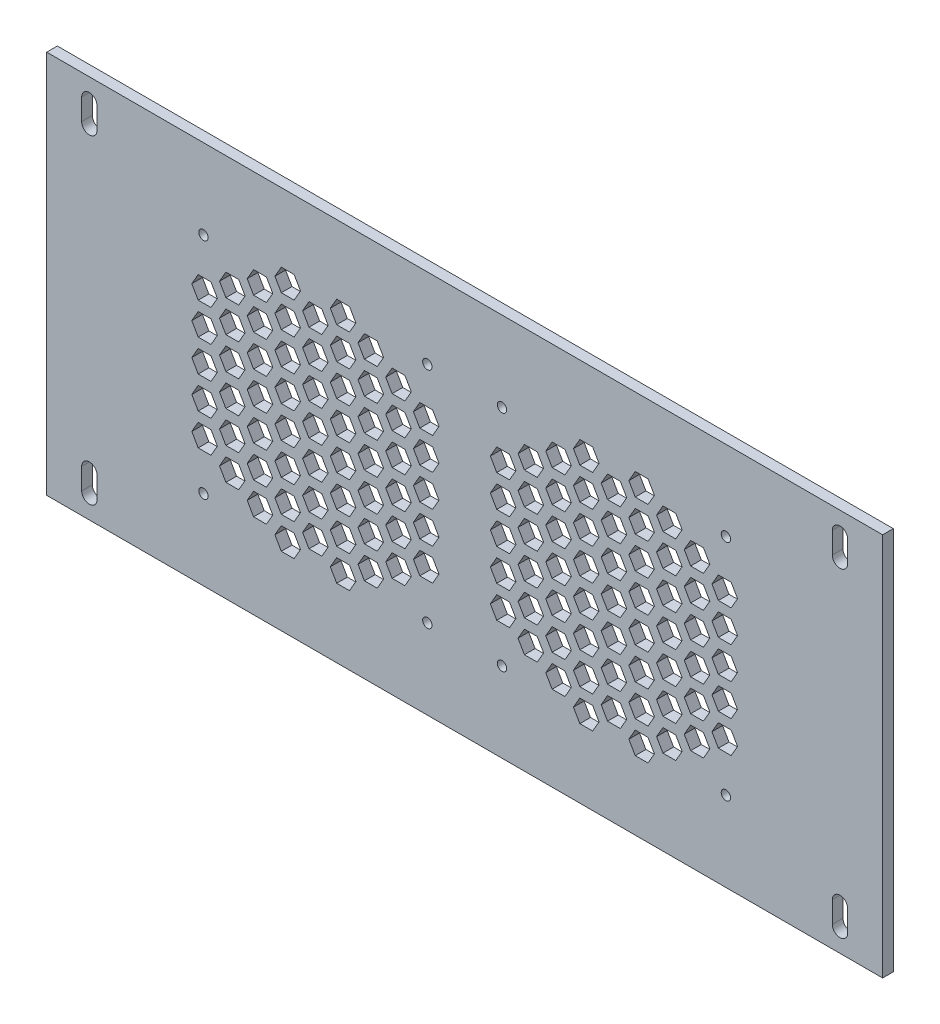
from build123d import *

# Parameters (mm, degrees)
SKETCH1_W                                = 392
SKETCH1_H                                = 180
BOSS_EXTRUDE1_DEPTH                      = 5
CUT_EXTRUDE3_REACH                       = 217.734
MIRROR1_AT_THE_SECOND_PLANE_COPY_1_REACH = 217.734
CUT_EXTRUDE2_REACH                       = 217.734
SKETCH4_R                                = 2.2
FILL_PATTERN1_DEPTH                      = 5
LPATTERN1_COUNT                          = 2
LPATTERN1_PITCH                          = 140


# Read off the part's stored shape, not the designer's step: Fill Pattern1
with BuildPart() as part:
    # Sketch1 → Boss-Extrude1 (new body)
    with BuildSketch(Plane.XY):
        Rectangle(SKETCH1_W, SKETCH1_H)
    extrude(amount=BOSS_EXTRUDE1_DEPTH)

    # Sketch5 → Cut-Extrude3 (cut, up to next)
    with BuildSketch(Plane.XY.offset(5), mode=Mode.PRIVATE) as cut_extrude3_sk1:
        with BuildLine():
            Line((172.4, -80), (172.4, -70))
            ThreePointArc((172.4, -70), (176, -66.4), (179.6, -70))
            Line((179.6, -70), (179.6, -80))
            ThreePointArc((179.6, -80), (176, -83.6), (172.4, -80))
        make_face()
    cut_extrude3_tool1 = extrude(cut_extrude3_sk1.sketch, amount=-CUT_EXTRUDE3_REACH, mode=Mode.PRIVATE) & part.part
    cut_extrude3 = cut_extrude3_tool1.solids().sort_by_distance((176, -75, 5))[0]
    add(cut_extrude3, mode=Mode.SUBTRACT)

    # Mirror1: Cut-Extrude3 across plane
    add(cut_extrude3.mirror(Plane.ZX), mode=Mode.SUBTRACT)

    # Mirror1 at the second plane: Cut-Extrude3 across plane
    add(cut_extrude3.mirror(Plane(origin=(0, 0, 0), x_dir=(0, 0, 1), z_dir=(1, 0, 0))), mode=Mode.SUBTRACT)

    # Mirror1 at the second plane copy 1 sketc → Mirror1 at the second plane copy 1 (cut, up to next)
    with BuildSketch(Plane(origin=(0, 0, 5), x_dir=(-1, 0, 0), z_dir=(0, 0, 1)), mode=Mode.PRIVATE) as mirror1_at_the_second_plane_copy_1_sk1:
        with BuildLine():
            Line((172.4, -80), (172.4, -70))
            ThreePointArc((172.4, -70), (176, -66.4), (179.6, -70))
            Line((179.6, -70), (179.6, -80))
            ThreePointArc((179.6, -80), (176, -83.6), (172.4, -80))
        make_face()
    mirror1_at_the_second_plane_copy_1_tool1 = extrude(mirror1_at_the_second_plane_copy_1_sk1.sketch, amount=-MIRROR1_AT_THE_SECOND_PLANE_COPY_1_REACH, mode=Mode.PRIVATE) & part.part
    add(mirror1_at_the_second_plane_copy_1_tool1.solids().sort_by_distance((-176, 75, 5))[0], mode=Mode.SUBTRACT)

    # Sketch4 → Cut-Extrude2 (cut, up to next)
    with BuildSketch(Plane.XY.offset(5), mode=Mode.PRIVATE) as cut_extrude2_sk1:
        with Locations((-122.5, 52.5)):
            Circle(SKETCH4_R)
    cut_extrude2_tool1 = extrude(cut_extrude2_sk1.sketch, amount=-CUT_EXTRUDE2_REACH, mode=Mode.PRIVATE) & part.part
    # Sketch4 → Cut-Extrude2 (cut, up to next)
    with BuildSketch(Plane.XY.offset(5), mode=Mode.PRIVATE) as cut_extrude2_sk2:
        with Locations((-17.5, 52.5)):
            Circle(SKETCH4_R)
    cut_extrude2_tool2 = extrude(cut_extrude2_sk2.sketch, amount=-CUT_EXTRUDE2_REACH, mode=Mode.PRIVATE) & part.part
    # Sketch4 → Cut-Extrude2 (cut, up to next)
    with BuildSketch(Plane.XY.offset(5), mode=Mode.PRIVATE) as cut_extrude2_sk3:
        with Locations((-17.5, -52.5)):
            Circle(SKETCH4_R)
    cut_extrude2_tool3 = extrude(cut_extrude2_sk3.sketch, amount=-CUT_EXTRUDE2_REACH, mode=Mode.PRIVATE) & part.part
    # Sketch4 → Cut-Extrude2 (cut, up to next)
    with BuildSketch(Plane.XY.offset(5), mode=Mode.PRIVATE) as cut_extrude2_sk4:
        with Locations((-122.5, -52.5)):
            Circle(SKETCH4_R)
    cut_extrude2_tool4 = extrude(cut_extrude2_sk4.sketch, amount=-CUT_EXTRUDE2_REACH, mode=Mode.PRIVATE) & part.part
    cut_extrude2_1 = cut_extrude2_tool1.solids().sort_by_distance((-122.5, 52.5, 5))[0]
    add(cut_extrude2_1, mode=Mode.SUBTRACT)
    cut_extrude2_2 = cut_extrude2_tool2.solids().sort_by_distance((-17.5, 52.5, 5))[0]
    add(cut_extrude2_2, mode=Mode.SUBTRACT)
    cut_extrude2_3 = cut_extrude2_tool3.solids().sort_by_distance((-17.5, -52.5, 5))[0]
    add(cut_extrude2_3, mode=Mode.SUBTRACT)
    cut_extrude2_4 = cut_extrude2_tool4.solids().sort_by_distance((-122.5, -52.5, 5))[0]
    add(cut_extrude2_4, mode=Mode.SUBTRACT)
    cut_extrude2 = cut_extrude2_1 + cut_extrude2_2 + cut_extrude2_3 + cut_extrude2_4  # Cut-Extrude2 as one shape, for the pattern or mirror that repeats it

    # Fill Pattern1 outline → Fill Pattern1 (cut)
    with BuildSketch(Plane.XY):
        Polygon((-88.990381057, 52.5), (-85.990381057, 47.303847577), (-79.990381057, 47.303847577), (-76.990381057, 52.5), (-79.990381057, 57.696152423), (-85.990381057, 57.696152423), align=None)
        Polygon((-63.009618943, 7.5), (-60.009618943, 2.303847577), (-54.009618943, 2.303847577), (-51.009618943, 7.5), (-54.009618943, 12.696152423), (-60.009618943, 12.696152423), align=None)
        Polygon((-76, 30), (-73, 24.803847577), (-67, 24.803847577), (-64, 30), (-67, 35.196152423), (-73, 35.196152423), align=None)
        Polygon((-37.02885683, -37.5), (-34.02885683, -42.696152423), (-28.02885683, -42.696152423), (-25.02885683, -37.5), (-28.02885683, -32.303847577), (-34.02885683, -32.303847577), align=None)
        Polygon((-50.019237886, -15), (-47.019237886, -20.196152423), (-41.019237886, -20.196152423), (-38.019237886, -15), (-41.019237886, -9.803847577), (-47.019237886, -9.803847577), align=None)
        Polygon((-60.009618943, 47.303847577), (-54.009618943, 47.303847577), (-51.009618943, 52.5), (-54.009618943, 57.696152423), (-60.009618943, 57.696152423), (-63.009618943, 52.5), align=None)
        Polygon((-105.97114317, 2.303847577), (-102.97114317, 7.5), (-105.97114317, 12.696152423), (-111.97114317, 12.696152423), (-114.97114317, 7.5), (-111.97114317, 2.303847577), align=None)
        Polygon((-118.961524227, -20.196152423), (-115.961524227, -15), (-118.961524227, -9.803847577), (-124.961524227, -9.803847577), (-127.961524227, -15), (-124.961524227, -20.196152423), align=None)
        Polygon((-92.980762114, 24.803847577), (-89.980762114, 30), (-92.980762114, 35.196152423), (-98.980762114, 35.196152423), (-101.980762114, 30), (-98.980762114, 24.803847577), align=None)
        Polygon((-76, -30), (-73, -35.196152423), (-67, -35.196152423), (-64, -30), (-67, -24.803847577), (-73, -24.803847577), align=None)
        Polygon((-88.990381057, -7.5), (-85.990381057, -12.696152423), (-79.990381057, -12.696152423), (-76.990381057, -7.5), (-79.990381057, -2.303847577), (-85.990381057, -2.303847577), align=None)
        Polygon((-63.009618943, -52.5), (-60.009618943, -57.696152423), (-54.009618943, -57.696152423), (-51.009618943, -52.5), (-54.009618943, -47.303847577), (-60.009618943, -47.303847577), align=None)
        Polygon((-101.980762114, 15), (-98.980762114, 9.803847577), (-92.980762114, 9.803847577), (-89.980762114, 15), (-92.980762114, 20.196152423), (-98.980762114, 20.196152423), align=None)
        Polygon((-114.97114317, 37.5), (-111.97114317, 32.303847577), (-105.97114317, 32.303847577), (-102.97114317, 37.5), (-105.97114317, 42.696152423), (-111.97114317, 42.696152423), align=None)
        Polygon((-124.961524227, -35.196152423), (-118.961524227, -35.196152423), (-115.961524227, -30), (-118.961524227, -24.803847577), (-124.961524227, -24.803847577), (-127.961524227, -30), align=None)
        Polygon((-98.980762114, -35.196152423), (-92.980762114, -35.196152423), (-89.980762114, -30), (-92.980762114, -24.803847577), (-98.980762114, -24.803847577), (-101.980762114, -30), align=None)
        Polygon((-21.038475773, -35.196152423), (-15.038475773, -35.196152423), (-12.038475773, -30), (-15.038475773, -24.803847577), (-21.038475773, -24.803847577), (-24.038475773, -30), align=None)
        Polygon((-47.019237886, -35.196152423), (-41.019237886, -35.196152423), (-38.019237886, -30), (-41.019237886, -24.803847577), (-47.019237886, -24.803847577), (-50.019237886, -30), align=None)
        Polygon((-79.990381057, -57.696152423), (-76.990381057, -52.5), (-79.990381057, -47.303847577), (-85.990381057, -47.303847577), (-88.990381057, -52.5), (-85.990381057, -57.696152423), align=None)
        Polygon((-28.02885683, 32.303847577), (-25.02885683, 37.5), (-28.02885683, 42.696152423), (-34.02885683, 42.696152423), (-37.02885683, 37.5), (-34.02885683, 32.303847577), align=None)
        Polygon((-54.009618943, -12.696152423), (-51.009618943, -7.5), (-54.009618943, -2.303847577), (-60.009618943, -2.303847577), (-63.009618943, -7.5), (-60.009618943, -12.696152423), align=None)
        Polygon((-41.019237886, 9.803847577), (-38.019237886, 15), (-41.019237886, 20.196152423), (-47.019237886, 20.196152423), (-50.019237886, 15), (-47.019237886, 9.803847577), align=None)
        Polygon((-76, -45), (-73, -50.196152423), (-67, -50.196152423), (-64, -45), (-67, -39.803847577), (-73, -39.803847577), align=None)
        Polygon((-101.980762114, 0), (-98.980762114, -5.196152423), (-92.980762114, -5.196152423), (-89.980762114, 0), (-92.980762114, 5.196152423), (-98.980762114, 5.196152423), align=None)
        Polygon((-88.990381057, -22.5), (-85.990381057, -27.696152423), (-79.990381057, -27.696152423), (-76.990381057, -22.5), (-79.990381057, -17.303847577), (-85.990381057, -17.303847577), align=None)
        Polygon((-114.97114317, 22.5), (-111.97114317, 17.303847577), (-105.97114317, 17.303847577), (-102.97114317, 22.5), (-105.97114317, 27.696152423), (-111.97114317, 27.696152423), align=None)
        Polygon((-98.980762114, -50.196152423), (-92.980762114, -50.196152423), (-89.980762114, -45), (-92.980762114, -39.803847577), (-98.980762114, -39.803847577), (-101.980762114, -45), align=None)
        Polygon((-47.019237886, -50.196152423), (-41.019237886, -50.196152423), (-38.019237886, -45), (-41.019237886, -39.803847577), (-47.019237886, -39.803847577), (-50.019237886, -45), align=None)
        Polygon((-54.009618943, -27.696152423), (-51.009618943, -22.5), (-54.009618943, -17.303847577), (-60.009618943, -17.303847577), (-63.009618943, -22.5), (-60.009618943, -27.696152423), align=None)
        Polygon((-28.02885683, 17.303847577), (-25.02885683, 22.5), (-28.02885683, 27.696152423), (-34.02885683, 27.696152423), (-37.02885683, 22.5), (-34.02885683, 17.303847577), align=None)
        Polygon((-41.019237886, -5.196152423), (-38.019237886, 0), (-41.019237886, 5.196152423), (-47.019237886, 5.196152423), (-50.019237886, 0), (-47.019237886, -5.196152423), align=None)
        Polygon((-127.961524227, 15), (-124.961524227, 9.803847577), (-118.961524227, 9.803847577), (-115.961524227, 15), (-118.961524227, 20.196152423), (-124.961524227, 20.196152423), align=None)
        Polygon((-114.97114317, -7.5), (-111.97114317, -12.696152423), (-105.97114317, -12.696152423), (-102.97114317, -7.5), (-105.97114317, -2.303847577), (-111.97114317, -2.303847577), align=None)
        Polygon((-21.038475773, 9.803847577), (-15.038475773, 9.803847577), (-12.038475773, 15), (-15.038475773, 20.196152423), (-21.038475773, 20.196152423), (-24.038475773, 15), align=None)
        Polygon((-73, 9.803847577), (-67, 9.803847577), (-64, 15), (-67, 20.196152423), (-73, 20.196152423), (-76, 15), align=None)
        Polygon((-88.990381057, -37.5), (-85.990381057, -42.696152423), (-79.990381057, -42.696152423), (-76.990381057, -37.5), (-79.990381057, -32.303847577), (-85.990381057, -32.303847577), align=None)
        Polygon((-101.980762114, -15), (-98.980762114, -20.196152423), (-92.980762114, -20.196152423), (-89.980762114, -15), (-92.980762114, -9.803847577), (-98.980762114, -9.803847577), align=None)
        Polygon((-127.961524227, 30), (-124.961524227, 24.803847577), (-118.961524227, 24.803847577), (-115.961524227, 30), (-118.961524227, 35.196152423), (-124.961524227, 35.196152423), align=None)
        Polygon((-85.990381057, 2.303847577), (-79.990381057, 2.303847577), (-76.990381057, 7.5), (-79.990381057, 12.696152423), (-85.990381057, 12.696152423), (-88.990381057, 7.5), align=None)
        Polygon((-34.02885683, 2.303847577), (-28.02885683, 2.303847577), (-25.02885683, 7.5), (-28.02885683, 12.696152423), (-34.02885683, 12.696152423), (-37.02885683, 7.5), align=None)
        Polygon((-73, -5.196152423), (-67, -5.196152423), (-64, 0), (-67, 5.196152423), (-73, 5.196152423), (-76, 0), align=None)
        Polygon((-124.961524227, -5.196152423), (-118.961524227, -5.196152423), (-115.961524227, 0), (-118.961524227, 5.196152423), (-124.961524227, 5.196152423), (-127.961524227, 0), align=None)
        Polygon((-21.038475773, -5.196152423), (-15.038475773, -5.196152423), (-12.038475773, 0), (-15.038475773, 5.196152423), (-21.038475773, 5.196152423), (-24.038475773, 0), align=None)
        Polygon((-105.97114317, -27.696152423), (-102.97114317, -22.5), (-105.97114317, -17.303847577), (-111.97114317, -17.303847577), (-114.97114317, -22.5), (-111.97114317, -27.696152423), align=None)
        Polygon((-67, 39.803847577), (-64, 45), (-67, 50.196152423), (-73, 50.196152423), (-76, 45), (-73, 39.803847577), align=None)
        Polygon((-79.990381057, 17.303847577), (-76.990381057, 22.5), (-79.990381057, 27.696152423), (-85.990381057, 27.696152423), (-88.990381057, 22.5), (-85.990381057, 17.303847577), align=None)
        Polygon((-34.02885683, -12.696152423), (-28.02885683, -12.696152423), (-25.02885683, -7.5), (-28.02885683, -2.303847577), (-34.02885683, -2.303847577), (-37.02885683, -7.5), align=None)
        Polygon((-54.009618943, 32.303847577), (-51.009618943, 37.5), (-54.009618943, 42.696152423), (-60.009618943, 42.696152423), (-63.009618943, 37.5), (-60.009618943, 32.303847577), align=None)
        Polygon((-34.02885683, -27.696152423), (-28.02885683, -27.696152423), (-25.02885683, -22.5), (-28.02885683, -17.303847577), (-34.02885683, -17.303847577), (-37.02885683, -22.5), align=None)
        Polygon((-41.019237886, 39.803847577), (-38.019237886, 45), (-41.019237886, 50.196152423), (-47.019237886, 50.196152423), (-50.019237886, 45), (-47.019237886, 39.803847577), align=None)
        Polygon((-54.009618943, 17.303847577), (-51.009618943, 22.5), (-54.009618943, 27.696152423), (-60.009618943, 27.696152423), (-63.009618943, 22.5), (-60.009618943, 17.303847577), align=None)
        Polygon((-60.009618943, -42.696152423), (-54.009618943, -42.696152423), (-51.009618943, -37.5), (-54.009618943, -32.303847577), (-60.009618943, -32.303847577), (-63.009618943, -37.5), align=None)
        Polygon((-111.97114317, -42.696152423), (-105.97114317, -42.696152423), (-102.97114317, -37.5), (-105.97114317, -32.303847577), (-111.97114317, -32.303847577), (-114.97114317, -37.5), align=None)
        Polygon((-67, -20.196152423), (-64, -15), (-67, -9.803847577), (-73, -9.803847577), (-76, -15), (-73, -20.196152423), align=None)
        Polygon((-41.019237886, 24.803847577), (-38.019237886, 30), (-41.019237886, 35.196152423), (-47.019237886, 35.196152423), (-50.019237886, 30), (-47.019237886, 24.803847577), align=None)
        Polygon((-92.980762114, 39.803847577), (-89.980762114, 45), (-92.980762114, 50.196152423), (-98.980762114, 50.196152423), (-101.980762114, 45), (-98.980762114, 39.803847577), align=None)
        Polygon((-15.038475773, 24.803847577), (-12.038475773, 30), (-15.038475773, 35.196152423), (-21.038475773, 35.196152423), (-24.038475773, 30), (-21.038475773, 24.803847577), align=None)
        Polygon((-79.990381057, 32.303847577), (-76.990381057, 37.5), (-79.990381057, 42.696152423), (-85.990381057, 42.696152423), (-88.990381057, 37.5), (-85.990381057, 32.303847577), align=None)
        Polygon((-21.038475773, -20.196152423), (-15.038475773, -20.196152423), (-12.038475773, -15), (-15.038475773, -9.803847577), (-21.038475773, -9.803847577), (-24.038475773, -15), align=None)
    fill_pattern1 = extrude(amount=FILL_PATTERN1_DEPTH, mode=Mode.SUBTRACT)

    # LPattern1: Cut-Extrude2, Fill Pattern1 ×2
    with Locations(*[(i * LPATTERN1_PITCH, 0, 0) for i in range(1, LPATTERN1_COUNT)]):
        add(cut_extrude2, mode=Mode.SUBTRACT)
        add(fill_pattern1, mode=Mode.SUBTRACT)


solid = part.part
